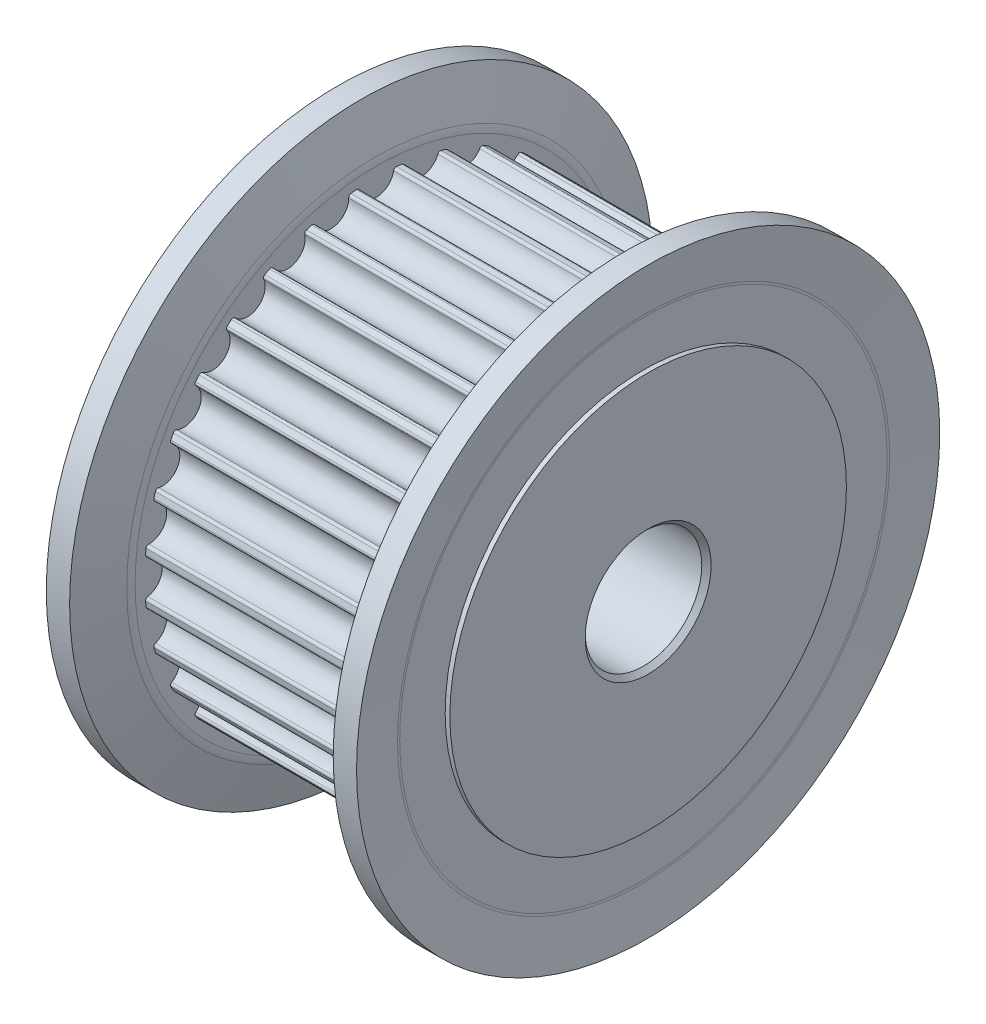
from build123d import *

# Parameters (mm, degrees)
FILLET1_R                = 1
FILLET2_R                = 1
FURO1_DEPTH              = 19.887098771
FURO1_DEPTH_BACK         = 19.887098771
FURO01_R                 = 2.5
CHAMFERA_SIZE            = 0.2
CUT_EXTRUDE1_DEPTH       = 5
FILLET3_R                = 0.11
CIRPATTERN1_COUNT        = 32
FILLET3_OF_CIRPATTERN1_R = 0.11


with BuildPart() as part:
    # Sketch1 → Revolve1 (revolve)
    with BuildSketch(Plane.XY, mode=Mode.PRIVATE) as revolve1_sk:
        Polygon((5, 8.5), (6.65, 8.5), (6.65, 0), (-6.65, 0), (-6.65, 8.5), (-5, 8.5), (-5, 9.93), (5, 9.93), align=None)
    revolve(revolve1_sk.sketch.rotate(Axis((11.370607254, 0, 0), (-1, 0, 0)), 90), axis=Axis((11.370607254, 0, 0), (-1, 0, 0)))

    # Furo01 → Furo1 (cut, two sides: drawn at the far end of the back side and taken through both)
    with BuildSketch(Plane(origin=(0, 0, 0), x_dir=(0, 0, -1), z_dir=(1, 0, 0)).offset(-FURO1_DEPTH_BACK)):
        Circle(FURO01_R)
    extrude(amount=FURO1_DEPTH + FURO1_DEPTH_BACK, mode=Mode.SUBTRACT)

    # ChamferA
    chamfera_edges = [part.edges().sort_by_distance(p)[0] for p in [
        (-6.65, 0, 2.5),
        (6.65, 0, 2.5),
    ]]
    chamfer(chamfera_edges, length=CHAMFERA_SIZE)

    # Sketch4 → Cut-Extrude1 (cut, symmetric)
    with BuildSketch(Plane(origin=(0, 0, 0), x_dir=(0, 0, -1), z_dir=(1, 0, 0))):
        with BuildLine():
            Line((-0.747858153, 9.874359178), (-0.944013694, 12.464302553))
            Line((-0.944013694, 12.464302553), (0.944013694, 12.464302553))
            Line((0.944013694, 12.464302553), (0.747858153, 9.874359178))
            ThreePointArc((0.747858153, 9.874359178), (0, 9.181), (-0.747858153, 9.874359178))
        make_face()
    cut_extrude1 = extrude(amount=CUT_EXTRUDE1_DEPTH, both=True, mode=Mode.SUBTRACT)

    # Fillet3
    fillet3_edges = [part.edges().sort_by_distance(p)[0] for p in [
        (0, 9.901641948, -0.749924479),
        (0, 9.901641948, 0.749924479),
    ]]
    fillet(fillet3_edges, radius=FILLET3_R)

    # CirPattern1: Cut-Extrude1 ×32 about axis
    cirpattern1_axis = Axis((0, 0, 0), (1, 0, 0))
    for i in range(1, CIRPATTERN1_COUNT):
        add(cut_extrude1.rotate(cirpattern1_axis, i * 360 / CIRPATTERN1_COUNT), mode=Mode.SUBTRACT)

    # Fillet3 of CirPattern1
    fillet3_of_cirpattern1_edges = [part.edges().sort_by_distance(p)[0] for p in [
        (0, 9.857687683, 1.196199626),
        (0, 9.565081667, 2.667229407),
        (0, 9.434908008, 3.09635445),
        (0, 8.860940661, 4.482034204),
        (0, 8.64955011, 4.877518109),
        (0, 7.816278675, 6.12459694),
        (0, 7.531794851, 6.471241482),
        (0, 6.471241482, 7.531794851),
        (0, 6.12459694, 7.816278675),
        (0, 4.877518109, 8.64955011),
        (0, 4.482034204, 8.860940661),
        (0, 3.09635445, 9.434908008),
        (0, 2.667229407, 9.565081667),
        (0, 1.196199626, 9.857687683),
        (0, 0.749924479, 9.901641948),
        (0, -0.749924479, 9.901641948),
        (0, -1.196199626, 9.857687683),
        (0, -2.667229407, 9.565081667),
        (0, -3.09635445, 9.434908008),
        (0, -4.482034204, 8.860940661),
        (0, -4.877518109, 8.64955011),
        (0, -6.12459694, 7.816278675),
        (0, -6.471241482, 7.531794851),
        (0, -7.531794851, 6.471241482),
        (0, -7.816278675, 6.12459694),
        (0, -8.64955011, 4.877518109),
        (0, -8.860940661, 4.482034204),
        (0, -9.434908008, 3.09635445),
        (0, -9.565081667, 2.667229407),
        (0, -9.857687683, 1.196199626),
        (0, -9.901641948, 0.749924479),
        (0, -9.901641948, -0.749924479),
        (0, -9.857687683, -1.196199626),
        (0, -9.565081667, -2.667229407),
        (0, -9.434908008, -3.09635445),
        (0, -8.860940661, -4.482034204),
        (0, -8.64955011, -4.877518109),
        (0, -7.816278675, -6.12459694),
        (0, -7.531794851, -6.471241482),
        (0, -6.471241482, -7.531794851),
        (0, -6.12459694, -7.816278675),
        (0, -4.877518109, -8.64955011),
        (0, -4.482034204, -8.860940661),
        (0, -3.09635445, -9.434908008),
        (0, -2.667229407, -9.565081667),
        (0, -1.196199626, -9.857687683),
        (0, -0.749924479, -9.901641948),
        (0, 0.749924479, -9.901641948),
        (0, 1.196199626, -9.857687683),
        (0, 2.667229407, -9.565081667),
        (0, 3.09635445, -9.434908008),
        (0, 4.482034204, -8.860940661),
        (0, 4.877518109, -8.64955011),
        (0, 6.12459694, -7.816278675),
        (0, 6.471241482, -7.531794851),
        (0, 7.531794851, -6.471241482),
        (0, 7.816278675, -6.12459694),
        (0, 8.64955011, -4.877518109),
        (0, 8.860940661, -4.482034204),
        (0, 9.434908008, -3.09635445),
        (0, 9.565081667, -2.667229407),
        (0, 9.857687683, -1.196199626),
    ]]
    fillet(fillet3_of_cirpattern1_edges, radius=FILLET3_OF_CIRPATTERN1_R)


with BuildPart() as body_2:
    # Sketch2 → Revolve2 (revolve)
    with BuildSketch(Plane.XY, mode=Mode.PRIVATE) as revolve2_sk:
        Polygon((5, 8.5), (5, 10.5), (5.65, 12.5), (6.65, 12.5), (6.45, 10.5), (6.45, 8.5), align=None)
        Polygon((-6.45, 8.5), (-5, 8.5), (-5, 10.5), (-5.65, 12.5), (-6.65, 12.5), (-6.45, 10.5), align=None)
    revolve(revolve2_sk.sketch.rotate(Axis((0, 0, 0), (1, 0, 0)), 90), axis=Axis((0, 0, 0), (1, 0, 0)))

    # Fillet1
    # the kernel refuses this fillet: 1 mm, written as the material it adds along each edge
    with BuildSketch(Plane(origin=(6.45, 0, 0), x_dir=(0, 0, 1), z_dir=(0, 1, 0))) as fillet1_piece_1:
        with BuildLine():
            CenterArc((10.5 - FILLET1_R * 0.0498756211209, FILLET1_R), FILLET1_R, 270, 5.710593137)
            Line((10.5 - FILLET1_R * 0.0498756211209, 0), (10.5, 0))
            Line((10.5, 0), (10.5 + FILLET1_R * 0.0496280979001, FILLET1_R * 0.00496280979001))
        make_face()
    revolve(axis=Axis((6.45, 0, 0), (1, 0, 0)))
    # the kernel refuses this fillet: 1 mm, written as the material it takes off along each edge
    with BuildSketch(Plane(origin=(5, 0, 0), x_dir=(0, 0, 1), z_dir=(0, 1, 0))) as fillet1_2_piece_1:
        with BuildLine():
            CenterArc((10.5 - FILLET1_R * 0.158421668433, FILLET1_R), FILLET1_R, 270, 18.004161606)
            Line((10.5 + FILLET1_R * 0.150664403905, FILLET1_R * 0.0489659312691), (10.5, 0))
            Line((10.5, 0), (10.5 - FILLET1_R * 0.158421668433, 0))
        make_face()
    revolve(axis=Axis((5, 0, 0), (1, 0, 0)), mode=Mode.SUBTRACT)

    # Fillet2
    # the kernel refuses this fillet: 1 mm, written as the material it adds along each edge
    with BuildSketch(Plane(origin=(-6.45, 0, 0), x_dir=(0, 0, 1), z_dir=(0, 1, 0))) as fillet2_piece_1:
        with BuildLine():
            CenterArc((10.5 - FILLET2_R * 0.0498756211209, -FILLET2_R), FILLET2_R, 84.289406863, 5.710593137)
            Line((10.5 - FILLET2_R * 0.0498756211209, 0), (10.5, 0))
            Line((10.5, 0), (10.5 + FILLET2_R * 0.0496280979001, -FILLET2_R * 0.00496280979001))
        make_face()
    revolve(axis=Axis((-6.45, 0, 0), (1, 0, 0)))
    # the kernel refuses this fillet: 1 mm, written as the material it takes off along each edge
    with BuildSketch(Plane(origin=(-5, 0, 0), x_dir=(0, 0, 1), z_dir=(0, 1, 0))) as fillet2_2_piece_1:
        with BuildLine():
            CenterArc((10.5 - FILLET2_R * 0.158421668433, -FILLET2_R), FILLET2_R, 71.995838394, 18.004161606)
            Line((10.5 + FILLET2_R * 0.150664403905, -FILLET2_R * 0.0489659312691), (10.5, 0))
            Line((10.5, 0), (10.5 - FILLET2_R * 0.158421668433, 0))
        make_face()
    revolve(axis=Axis((-5, 0, 0), (1, 0, 0)), mode=Mode.SUBTRACT)


solid = Compound([part.part, body_2.part])
